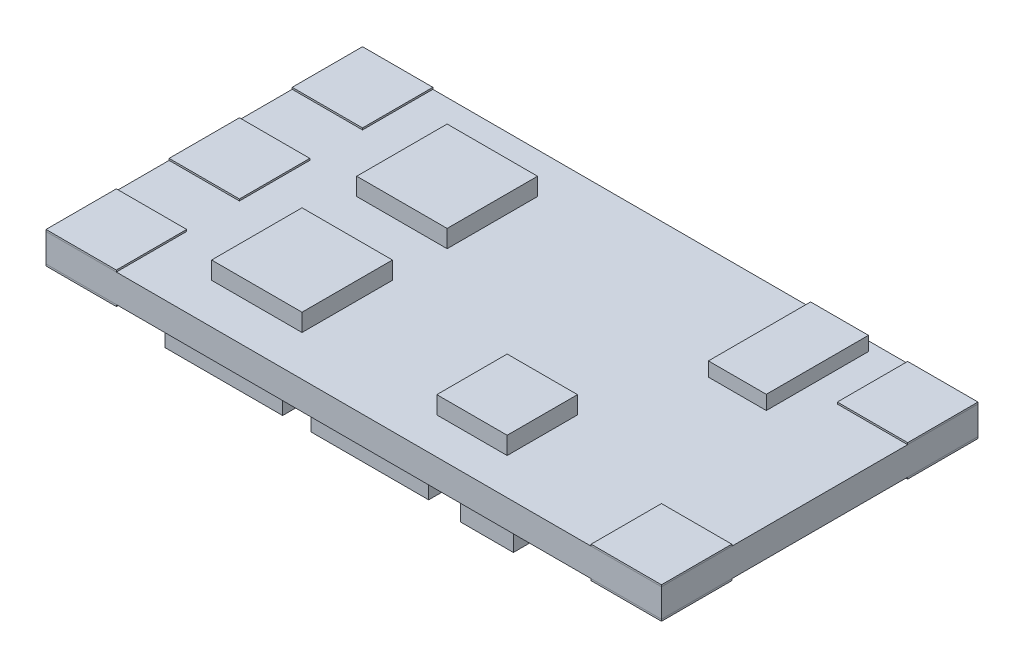
from build123d import *

# Parameters (mm, degrees)
SKETCH1_W             = 35
SKETCH1_H             = 18
BOSS_EXTRUDE1_DEPTH   = 1.6
SKETCH2_W             = 3.290634233
SKETCH2_H             = 5.810026068
BOSS_EXTRUDE2_DEPTH   = 0.8
SKETCH3_W             = 4
SKETCH3_H             = 4
BOSS_EXTRUDE3_DEPTH   = 1
SKETCH4_W             = 5.141615989
SKETCH4_H             = 5.141615989
BOSS_EXTRUDE4_DEPTH   = 1
BOSS_EXTRUDE4_2_DEPTH = 1
SKETCH5_W             = 4
SKETCH5_H             = 4
BOSS_EXTRUDE5_DEPTH   = 0.1
BOSS_EXTRUDE5_2_DEPTH = 0.1
BOSS_EXTRUDE5_3_DEPTH = 0.1
BOSS_EXTRUDE5_4_DEPTH = 0.1
BOSS_EXTRUDE5_5_DEPTH = 0.1
SKETCH6_W             = 6.694846846
SKETCH6_H             = 4.476078856
BOSS_EXTRUDE6_DEPTH   = 1.5
BOSS_EXTRUDE6_2_DEPTH = 1.5
BOSS_EXTRUDE6_3_DEPTH = 1.5
BOSS_EXTRUDE6_4_DEPTH = 1.5
BOSS_EXTRUDE6_5_DEPTH = 1.5
BOSS_EXTRUDE6_6_DEPTH = 1.5
SKETCH7_W             = 3
SKETCH7_H             = 1.6
BOSS_EXTRUDE7_DEPTH   = 1.5
BOSS_EXTRUDE7_2_DEPTH = 1.5
BOSS_EXTRUDE7_3_DEPTH = 1.5
BOSS_EXTRUDE7_4_DEPTH = 1.5
BOSS_EXTRUDE7_5_DEPTH = 1.5
BOSS_EXTRUDE7_6_DEPTH = 1.5
BOSS_EXTRUDE7_7_DEPTH = 1.5
BOSS_EXTRUDE7_8_DEPTH = 1.5


with BuildPart() as part:
    # Sketch1 → Boss-Extrude1 (new body)
    with BuildSketch(Plane(origin=(0, 0, 0), x_dir=(1, 0, 0), z_dir=(0, 1, 0))):
        Rectangle(SKETCH1_W, SKETCH1_H)
    extrude(amount=BOSS_EXTRUDE1_DEPTH)


with BuildPart() as body_2:
    # Sketch2 → Boss-Extrude2 (new body)
    with BuildSketch(Plane(origin=(0, 1.6, 0), x_dir=(1, 0, 0), z_dir=(0, 1, 0))):
        with Locations((10.154691578, 5.565799308)):
            Rectangle(SKETCH2_W, SKETCH2_H)
    extrude(amount=BOSS_EXTRUDE2_DEPTH)


with BuildPart() as body_3:
    # Sketch3 → Boss-Extrude3 (new body)
    with BuildSketch(Plane(origin=(0, 1.6, 0), x_dir=(1, 0, 0), z_dir=(0, 1, 0))):
        with Locations((4.647932234, -4.923097309)):
            Rectangle(SKETCH3_W, SKETCH3_H)
    extrude(amount=BOSS_EXTRUDE3_DEPTH)


with BuildPart() as body_4:
    # Sketch4 → Boss-Extrude4 (new body)
    with BuildSketch(Plane(origin=(0, 1.6, 0), x_dir=(1, 0, 0), z_dir=(0, 1, 0))):
        with Locations((-7.815256304, -4.126146832)):
            Rectangle(SKETCH4_W, SKETCH4_H)
    extrude(amount=BOSS_EXTRUDE4_DEPTH)


with BuildPart() as body_5:
    # Sketch4 → Boss-Extrude4 2 (new body)
    with BuildSketch(Plane(origin=(0, 1.6, 0), x_dir=(1, 0, 0), z_dir=(0, 1, 0))):
        with Locations((-7.815256304, 4.126146832)):
            Rectangle(SKETCH4_W, SKETCH4_H)
    extrude(amount=BOSS_EXTRUDE4_2_DEPTH)


with BuildPart() as body_6:
    # Sketch5 → Boss-Extrude5 (new body)
    with BuildSketch(Plane(origin=(0, 1.6, 0), x_dir=(1, 0, 0), z_dir=(0, 1, 0))):
        with Locations((-15.5, 7)):
            Rectangle(SKETCH5_W, SKETCH5_H)
    extrude(amount=BOSS_EXTRUDE5_DEPTH)


with BuildPart() as body_7:
    # Sketch5 → Boss-Extrude5 2 (new body)
    with BuildSketch(Plane(origin=(0, 1.6, 0), x_dir=(1, 0, 0), z_dir=(0, 1, 0))):
        with Locations((-15.5, 0)):
            Rectangle(SKETCH5_W, SKETCH5_H)
    extrude(amount=BOSS_EXTRUDE5_2_DEPTH)


with BuildPart() as body_8:
    # Sketch5 → Boss-Extrude5 3 (new body)
    with BuildSketch(Plane(origin=(0, 1.6, 0), x_dir=(1, 0, 0), z_dir=(0, 1, 0))):
        with Locations((15.5, -7)):
            Rectangle(SKETCH5_W, SKETCH5_H)
    extrude(amount=BOSS_EXTRUDE5_3_DEPTH)


with BuildPart() as body_9:
    # Sketch5 → Boss-Extrude5 4 (new body)
    with BuildSketch(Plane(origin=(0, 1.6, 0), x_dir=(1, 0, 0), z_dir=(0, 1, 0))):
        with Locations((-15.5, -7)):
            Rectangle(SKETCH5_W, SKETCH5_H)
    extrude(amount=BOSS_EXTRUDE5_4_DEPTH)


with BuildPart() as body_10:
    # Sketch5 → Boss-Extrude5 5 (new body)
    with BuildSketch(Plane(origin=(0, 1.6, 0), x_dir=(1, 0, 0), z_dir=(0, 1, 0))):
        with Locations((15.5, 7)):
            Rectangle(SKETCH5_W, SKETCH5_H)
    extrude(amount=BOSS_EXTRUDE5_5_DEPTH)


with BuildPart() as body_11:
    # Mirror1: mirrored copy
    add(body_6.part.mirror(Plane.ZX.offset(0.8)))


with BuildPart() as body_12:
    # Mirror1 2: mirrored copy
    add(body_7.part.mirror(Plane.ZX.offset(0.8)))


with BuildPart() as body_13:
    # Mirror1 3: mirrored copy
    add(body_9.part.mirror(Plane.ZX.offset(0.8)))


with BuildPart() as body_14:
    # Mirror1 4: mirrored copy
    add(body_10.part.mirror(Plane.ZX.offset(0.8)))


with BuildPart() as body_15:
    # Mirror1 5: mirrored copy
    add(body_8.part.mirror(Plane.ZX.offset(0.8)))


with BuildPart() as body_16:
    # Sketch6 → Boss-Extrude6 (new body)
    with BuildSketch(Plane.XZ):
        with Locations((-8.152576577, -6)):
            Rectangle(SKETCH6_W, SKETCH6_H)
    extrude(amount=BOSS_EXTRUDE6_DEPTH)


with BuildPart() as body_17:
    # Sketch6 → Boss-Extrude6 2 (new body)
    with BuildSketch(Plane.XZ):
        with Locations((-8.152576577, 6)):
            Rectangle(SKETCH6_W, SKETCH6_H)
    extrude(amount=BOSS_EXTRUDE6_2_DEPTH)


with BuildPart() as body_18:
    # Sketch6 → Boss-Extrude6 3 (new body)
    with BuildSketch(Plane.XZ):
        with Locations((-8.152576577, 0)):
            Rectangle(SKETCH6_W, SKETCH6_H)
    extrude(amount=BOSS_EXTRUDE6_3_DEPTH)


with BuildPart() as body_19:
    # Sketch6 → Boss-Extrude6 4 (new body)
    with BuildSketch(Plane.XZ):
        with Locations((0.152576577, -6)):
            Rectangle(SKETCH6_W, SKETCH6_H)
    extrude(amount=BOSS_EXTRUDE6_4_DEPTH)


with BuildPart() as body_20:
    # Sketch6 → Boss-Extrude6 5 (new body)
    with BuildSketch(Plane.XZ):
        with Locations((0.152576577, 0)):
            Rectangle(SKETCH6_W, SKETCH6_H)
    extrude(amount=BOSS_EXTRUDE6_5_DEPTH)


with BuildPart() as body_21:
    # Sketch6 → Boss-Extrude6 6 (new body)
    with BuildSketch(Plane.XZ):
        with Locations((0.152576577, 6)):
            Rectangle(SKETCH6_W, SKETCH6_H)
    extrude(amount=BOSS_EXTRUDE6_6_DEPTH)


with BuildPart() as body_22:
    # Sketch7 → Boss-Extrude7 (new body)
    with BuildSketch(Plane.XZ):
        with Locations((7, 5.444444444)):
            Rectangle(SKETCH7_W, SKETCH7_H)
    extrude(amount=BOSS_EXTRUDE7_DEPTH)


with BuildPart() as body_23:
    # Sketch7 → Boss-Extrude7 2 (new body)
    with BuildSketch(Plane.XZ):
        with Locations((7, 7.622222222)):
            Rectangle(SKETCH7_W, SKETCH7_H)
    extrude(amount=BOSS_EXTRUDE7_2_DEPTH)


with BuildPart() as body_24:
    # Sketch7 → Boss-Extrude7 3 (new body)
    with BuildSketch(Plane.XZ):
        with Locations((7, 3.266666667)):
            Rectangle(SKETCH7_W, SKETCH7_H)
    extrude(amount=BOSS_EXTRUDE7_3_DEPTH)


with BuildPart() as body_25:
    # Sketch7 → Boss-Extrude7 4 (new body)
    with BuildSketch(Plane.XZ):
        with Locations((7, 1.088888889)):
            Rectangle(SKETCH7_W, SKETCH7_H)
    extrude(amount=BOSS_EXTRUDE7_4_DEPTH)


with BuildPart() as body_26:
    # Sketch7 → Boss-Extrude7 5 (new body)
    with BuildSketch(Plane.XZ):
        with Locations((7, -1.088888889)):
            Rectangle(SKETCH7_W, SKETCH7_H)
    extrude(amount=BOSS_EXTRUDE7_5_DEPTH)


with BuildPart() as body_27:
    # Sketch7 → Boss-Extrude7 6 (new body)
    with BuildSketch(Plane.XZ):
        with Locations((7, -3.266666667)):
            Rectangle(SKETCH7_W, SKETCH7_H)
    extrude(amount=BOSS_EXTRUDE7_6_DEPTH)


with BuildPart() as body_28:
    # Sketch7 → Boss-Extrude7 7 (new body)
    with BuildSketch(Plane.XZ):
        with Locations((7, -5.444444444)):
            Rectangle(SKETCH7_W, SKETCH7_H)
    extrude(amount=BOSS_EXTRUDE7_7_DEPTH)


with BuildPart() as body_29:
    # Sketch7 → Boss-Extrude7 8 (new body)
    with BuildSketch(Plane.XZ):
        with Locations((7, -7.622222222)):
            Rectangle(SKETCH7_W, SKETCH7_H)
    extrude(amount=BOSS_EXTRUDE7_8_DEPTH)


solid = Compound([part.part, body_2.part, body_3.part, body_4.part, body_5.part, body_6.part, body_7.part, body_8.part, body_9.part, body_10.part, body_11.part, body_12.part, body_13.part, body_14.part, body_15.part, body_16.part, body_17.part, body_18.part, body_19.part, body_20.part, body_21.part, body_22.part, body_23.part, body_24.part, body_25.part, body_26.part, body_27.part, body_28.part, body_29.part])
